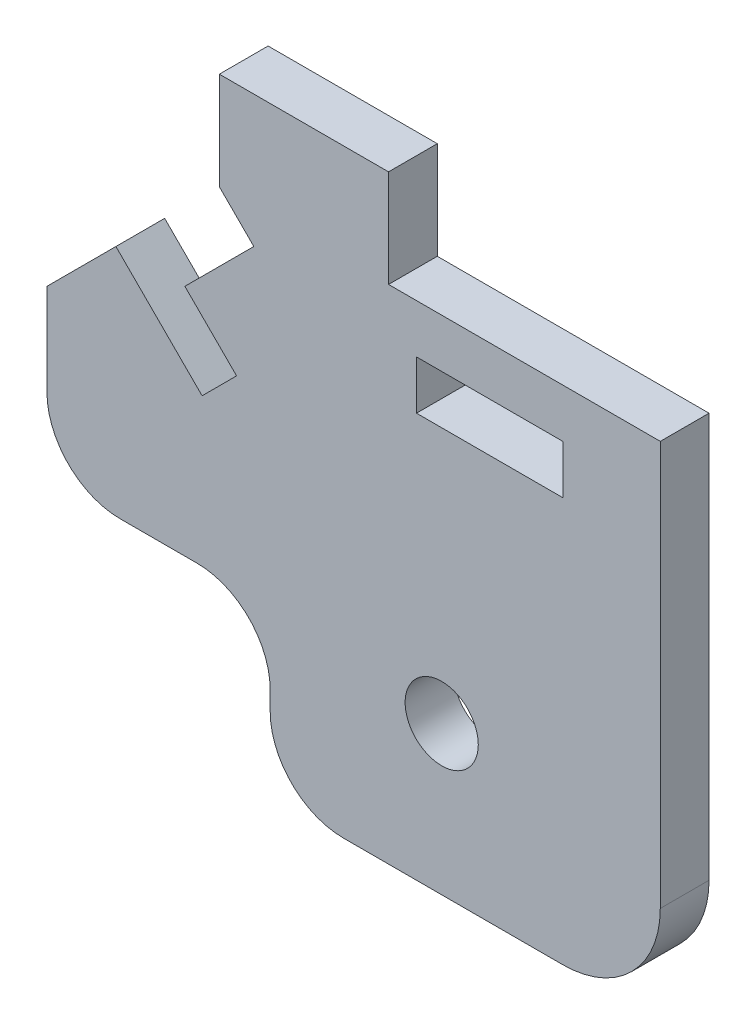
from build123d import *

# Parameters (mm, degrees)
MODEL_R             = 1.5
MODEL_W             = 6
MODEL_H             = 2
BOSS_EXTRUDE1_DEPTH = 2


with BuildPart() as part:
    # Model → Boss-Extrude1 (new body)
    with BuildSketch(Plane.XY):
        with BuildLine():
            Line((6.363961031, 1.171572875), (2.828427125, 4.707106781))
            Line((2.828427125, 4.707106781), (0, 1.878679656))
            Line((0, 1.878679656), (0, -1.878679656))
            ThreePointArc((0, -1.878679656), (0.878679656, -4), (3, -4.878679656))
            Line((3, -4.878679656), (5.828427125, -4.878679656))
            Line((5.828427125, -4.878679656), (6.156854249, -4.878679656))
            ThreePointArc((6.156854249, -4.878679656), (8.278174593, -5.757359313), (9.156854249, -7.878679656))
            Line((9.156854249, -7.878679656), (9.156854249, -8.641362585))
            ThreePointArc((9.156854249, -8.641362585), (10.035533906, -10.762682929), (12.156854249, -11.641362585))
            Line((12.156854249, -11.641362585), (21.156854249, -11.641362585))
            ThreePointArc((21.156854249, -11.641362585), (23.985281374, -10.46978971), (25.156854249, -7.641362585))
            Line((25.156854249, -7.641362585), (25.156854249, 8.949747468))
            Line((25.156854249, 8.949747468), (14.01040764, 8.949747468))
            Line((14.01040764, 8.949747468), (14.01040764, 12.949747468))
            Line((14.01040764, 12.949747468), (7.071067812, 12.949747468))
            Line((7.071067812, 12.949747468), (7.071067812, 8.949747468))
            Line((7.071067812, 8.949747468), (8.485281374, 7.535533906))
            Line((8.485281374, 7.535533906), (5.656854249, 4.707106781))
            Line((5.656854249, 4.707106781), (7.778174593, 2.585786438))
            Line((7.778174593, 2.585786438), (6.363961031, 1.171572875))
        make_face()
        with Locations((16.191687414, -5.558946351)):
            Circle(MODEL_R, mode=Mode.SUBTRACT)
        with Locations((18.156854249, 5.949747468)):
            Rectangle(MODEL_W, MODEL_H, mode=Mode.SUBTRACT)
    extrude(amount=BOSS_EXTRUDE1_DEPTH)


solid = part.part
